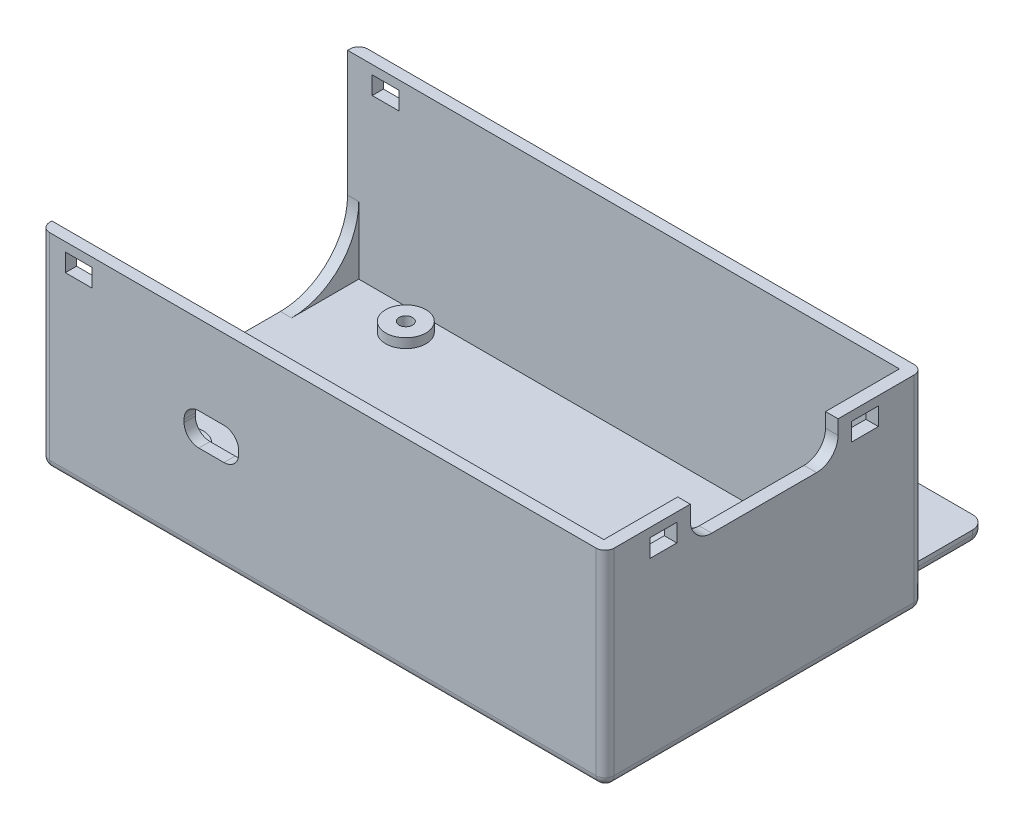
from build123d import *

# Parameters (mm, degrees)
SKETCH1_W           = 126
SKETCH1_H           = 71
BOSS_EXTRUDE1_DEPTH = 46
SKETCH2_W           = 20
SKETCH2_H           = 20.5
BOSS_EXTRUDE2_DEPTH = 3
SKETCH3_W           = 120.7
SKETCH3_H           = 66
CUT_EXTRUDE1_DEPTH  = 43
CUT_EXTRUDE2_REACH  = 147.355
CUT_EXTRUDE3_REACH  = 147.355
SKETCH5_W           = 6
SKETCH5_H           = 4
SKETCH6_W           = 6
SKETCH6_H           = 4
CUT_EXTRUDE4_DEPTH  = 121.238305045
CUT_EXTRUDE5_REACH  = 122.238
SKETCH8_R           = 2.4
CUT_EXTRUDE6_DEPTH  = 95.625577937
FILLET1_R           = 3
FILLET2_R           = 4
FILLET3_R           = 2
SKETCH9_R           = 4.5
BOSS_EXTRUDE3_DEPTH = 2.1
SKETCH10_R          = 1.5
CUT_EXTRUDE7_DEPTH  = 94.689967446


with BuildPart() as part:
    # Sketch1 → Boss-Extrude1 (new body)
    with BuildSketch(Plane(origin=(0, 0, 0), x_dir=(1, 0, 0), z_dir=(0, 1, 0))):
        Rectangle(SKETCH1_W, SKETCH1_H)
    extrude(amount=BOSS_EXTRUDE1_DEPTH)

    # Sketch2 → Boss-Extrude2 (add)
    with BuildSketch(Plane.XZ):
        with Locations((-46.5, -45.75)):
            Rectangle(SKETCH2_W, SKETCH2_H)
        with Locations((46.5, -45.75)):
            Rectangle(SKETCH2_W, SKETCH2_H)
    extrude(amount=-BOSS_EXTRUDE2_DEPTH)

    # Sketch3 → Cut-Extrude1 (cut)
    with BuildSketch(Plane(origin=(0, 46, 0), x_dir=(1, 0, 0), z_dir=(0, 1, 0))):
        with Locations((-0.15, 0)):
            Rectangle(SKETCH3_W, SKETCH3_H)
    extrude(amount=-CUT_EXTRUDE1_DEPTH, mode=Mode.SUBTRACT)

    # Sketch4 → Cut-Extrude2 (cut, up to next)
    with BuildSketch(Plane.ZY.offset(63), mode=Mode.PRIVATE) as cut_extrude2_sk1:
        with BuildLine():
            Line((-33, 46), (33, 46))
            Line((33, 46), (33, 18))
            ThreePointArc((33, 18), (28.606601718, 7.393398282), (18, 3))
            Line((18, 3), (-18, 3))
            ThreePointArc((-18, 3), (-28.606601718, 7.393398282), (-33, 18))
            Line((-33, 18), (-33, 46))
        make_face()
    cut_extrude2_tool1 = extrude(cut_extrude2_sk1.sketch, amount=-CUT_EXTRUDE2_REACH, mode=Mode.PRIVATE) & part.part
    add(cut_extrude2_tool1.solids().sort_by_distance((-63, 25.139342, 0))[0], mode=Mode.SUBTRACT)

    # Sketch5 → Cut-Extrude3 (cut, up to next)
    with BuildSketch(Plane(origin=(63, 0, 0), x_dir=(0, 0, -1), z_dir=(1, 0, 0)), mode=Mode.PRIVATE) as cut_extrude3_sk1:
        with BuildLine():
            Line((-16.5, 46), (16.5, 46))
            Line((16.5, 46), (16.5, 42.8))
            ThreePointArc((16.5, 42.8), (15.09411255, 39.40588745), (11.7, 38))
            Line((11.7, 38), (-11.7, 38))
            ThreePointArc((-11.7, 38), (-15.09411255, 39.40588745), (-16.5, 42.8))
            Line((-16.5, 42.8), (-16.5, 46))
        make_face()
    cut_extrude3_tool1 = extrude(cut_extrude3_sk1.sketch, amount=-CUT_EXTRUDE3_REACH, mode=Mode.PRIVATE) & part.part
    # Sketch5 → Cut-Extrude3 (cut, up to next)
    with BuildSketch(Plane(origin=(63, 0, 0), x_dir=(0, 0, -1), z_dir=(1, 0, 0)), mode=Mode.PRIVATE) as cut_extrude3_sk2:
        with Locations((22.5, 42)):
            Rectangle(SKETCH5_W, SKETCH5_H)
    cut_extrude3_tool2 = extrude(cut_extrude3_sk2.sketch, amount=-CUT_EXTRUDE3_REACH, mode=Mode.PRIVATE) & part.part
    # Sketch5 → Cut-Extrude3 (cut, up to next)
    with BuildSketch(Plane(origin=(63, 0, 0), x_dir=(0, 0, -1), z_dir=(1, 0, 0)), mode=Mode.PRIVATE) as cut_extrude3_sk3:
        with Locations((-22.5, 42)):
            Rectangle(SKETCH5_W, SKETCH5_H)
    cut_extrude3_tool3 = extrude(cut_extrude3_sk3.sketch, amount=-CUT_EXTRUDE3_REACH, mode=Mode.PRIVATE) & part.part
    add(cut_extrude3_tool1.solids().sort_by_distance((63, 42.113938, 0))[0], mode=Mode.SUBTRACT)
    add(cut_extrude3_tool2.solids().sort_by_distance((63, 42, -22.5))[0], mode=Mode.SUBTRACT)
    add(cut_extrude3_tool3.solids().sort_by_distance((63, 42, 22.5))[0], mode=Mode.SUBTRACT)

    # Sketch6 → Cut-Extrude4 (cut, through all)
    with BuildSketch(Plane.XY.offset(35.5)):
        with Locations((-54.5, 42)):
            Rectangle(SKETCH6_W, SKETCH6_H)
    extrude(amount=-CUT_EXTRUDE4_DEPTH, mode=Mode.SUBTRACT)

    # Sketch7 → Cut-Extrude5 (cut, up to next)
    with BuildSketch(Plane.XY.offset(35.5), mode=Mode.PRIVATE) as cut_extrude5_sk1:
        with BuildLine():
            Line((-27.7, 28.2), (-22.1, 28.2))
            ThreePointArc((-22.1, 28.2), (-19.766547622, 27.233452378), (-18.8, 24.9))
            Line((-18.8, 24.9), (-18.8, 24.3))
            ThreePointArc((-18.8, 24.3), (-19.766547622, 21.966547622), (-22.1, 21))
            Line((-22.1, 21), (-27.7, 21))
            ThreePointArc((-27.7, 21), (-30.033452378, 21.966547622), (-31, 24.3))
            Line((-31, 24.3), (-31, 24.9))
            ThreePointArc((-31, 24.9), (-30.033452378, 27.233452378), (-27.7, 28.2))
        make_face()
    cut_extrude5_tool1 = extrude(cut_extrude5_sk1.sketch, amount=-CUT_EXTRUDE5_REACH, mode=Mode.PRIVATE) & part.part
    add(cut_extrude5_tool1.solids().sort_by_distance((-24.9, 24.6, 35.5))[0], mode=Mode.SUBTRACT)

    # Sketch8 → Cut-Extrude6 (cut, through all)
    with BuildSketch(Plane(origin=(0, 3, 0), x_dir=(1, 0, 0), z_dir=(0, 1, 0))):
        with Locations((-46.5, 46)):
            Circle(SKETCH8_R)
        with Locations((46.5, 46)):
            Circle(SKETCH8_R)
    extrude(amount=-CUT_EXTRUDE6_DEPTH, mode=Mode.SUBTRACT)

    # Fillet1
    fillet1_edges = [part.edges().sort_by_distance(p)[0] for p in [
        (36.5, 1.5, -56),
        (56.5, 1.5, -56),
        (-36.5, 1.5, -56),
        (-56.5, 1.5, -56),
    ]]
    fillet(fillet1_edges, radius=FILLET1_R)

    # Fillet2
    fillet2_edges = [part.edges().sort_by_distance(p)[0] for p in [
        (-56.5, 1.5, -35.5),
        (-36.5, 1.5, -35.5),
        (56.5, 1.5, -35.5),
        (36.5, 1.5, -35.5),
    ]]
    fillet(fillet2_edges, radius=FILLET2_R)

    # Fillet3
    fillet3_edges = [part.edges().sort_by_distance(p)[0] for p in [
        (-63, 23, 35.5),
        (-63, 23, -35.5),
        (63, 23, -35.5),
        (63, 23, 35.5),
        (-61.75, 0, -35.5),
        (-57.671572875, 0, -36.671572875),
        (-56.5, 0, -46.25),
        (-55.621320344, 0, -55.121320344),
        (-46.5, 0, -56),
        (-37.378679656, 0, -55.121320344),
        (-36.5, 0, -46.25),
        (-35.328427125, 0, -36.671572875),
        (0, 0, -35.5),
        (35.328427125, 0, -36.671572875),
        (36.5, 0, -46.25),
        (37.378679656, 0, -55.121320344),
        (46.5, 0, -56),
        (55.621320344, 0, -55.121320344),
        (56.5, 0, -46.25),
        (61.75, 0, -35.5),
        (57.671572875, 0, -36.671572875),
        (63, 0, 0),
        (0, 0, 35.5),
        (-63, 0, 0),
    ]]
    fillet(fillet3_edges, radius=FILLET3_R)

    # Sketch9 → Boss-Extrude3 (add)
    with BuildSketch(Plane(origin=(0, 3, 0), x_dir=(1, 0, 0), z_dir=(0, 1, 0))):
        with Locations((-45, 28)):
            Circle(SKETCH9_R)
        with Locations((-46.4, -20.3)):
            Circle(SKETCH9_R)
        with Locations((31, 18)):
            Circle(SKETCH9_R)
        with Locations((36.6, -20.3)):
            Circle(SKETCH9_R)
    extrude(amount=BOSS_EXTRUDE3_DEPTH)

    # Sketch10 → Cut-Extrude7 (cut, through all)
    with BuildSketch(Plane(origin=(0, 5.1, 0), x_dir=(1, 0, 0), z_dir=(0, 1, 0))):
        with Locations((-45, 28)):
            Circle(SKETCH10_R)
        with Locations((-46.4, -20.3)):
            Circle(SKETCH10_R)
        with Locations((36.6, -20.3)):
            Circle(SKETCH10_R)
    extrude(amount=-CUT_EXTRUDE7_DEPTH, mode=Mode.SUBTRACT)


solid = part.part
